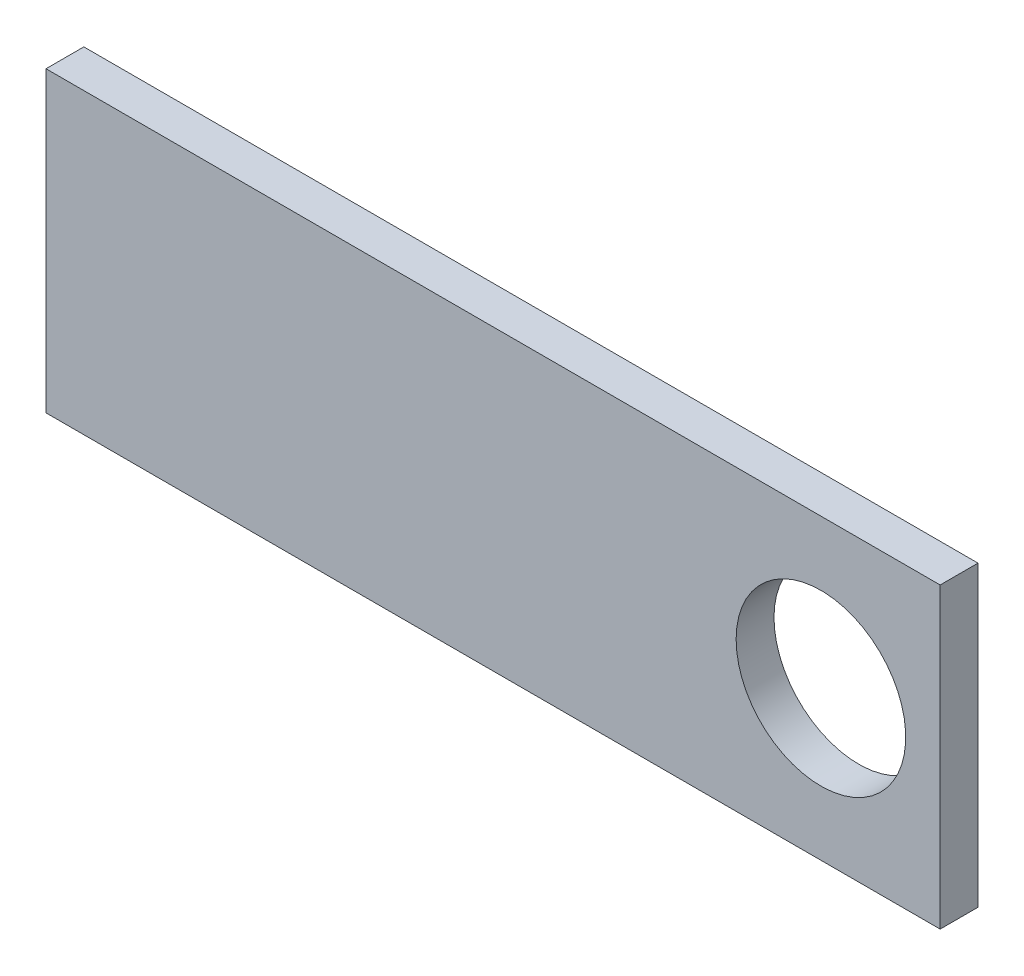
from build123d import *

# Parameters (mm, degrees)
SKETCH1_W           = 150
SKETCH1_H           = 50
BOSS_EXTRUDE1_DEPTH = 6.35
SKETCH2_R           = 14.225
CUT_EXTRUDE1_DEPTH  = 159.241342575


with BuildPart() as part:
    # Sketch1 → Boss-Extrude1 (new body)
    with BuildSketch(Plane.XY):
        with Locations((75, -25)):
            Rectangle(SKETCH1_W, SKETCH1_H)
    extrude(amount=BOSS_EXTRUDE1_DEPTH)

    # Sketch2 → Cut-Extrude1 (cut, through all)
    with BuildSketch(Plane(origin=(0, 0, 0), x_dir=(-1, 0, 0), z_dir=(0, 0, -1))):
        with Locations((-130, -25)):
            Circle(SKETCH2_R)
    extrude(amount=-CUT_EXTRUDE1_DEPTH, mode=Mode.SUBTRACT)


solid = part.part
